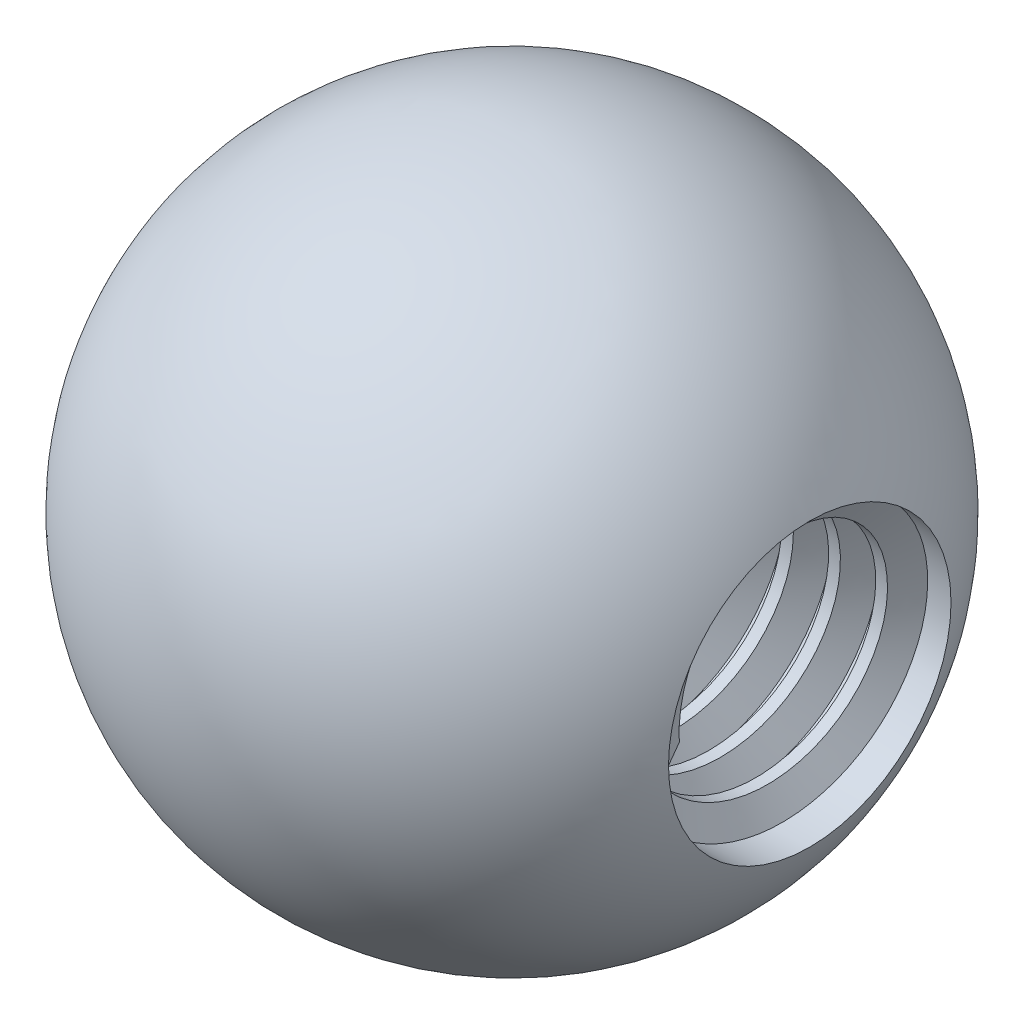
from build123d import *

# Parameters (mm, degrees)
SKETCH8_R          = 3
CUT_EXTRUDE1_DEPTH = 7
THREAD1_PITCH      = 1


with BuildPart() as part:
    # Sketch1 → Revolve1 (revolve)
    with BuildSketch(Plane.XY):
        with BuildLine():
            Line((-7, 0), (7, 0))
            ThreePointArc((7, 0), (0, 7), (-7, 0))
        make_face()
    revolve(axis=Axis((0, 0, 0), (1, 0, 0)))

    # Sketch8 → Cut-Extrude1 (cut)
    with BuildSketch(Plane(origin=(7, 0, 0), x_dir=(0, 0, -1), z_dir=(1, 0, 0))):
        Circle(SKETCH8_R)
    extrude(amount=-CUT_EXTRUDE1_DEPTH, mode=Mode.SUBTRACT)

    # Thread1: the profile of Thread Profile1 profile screwed along a right-hand helix of 7 turns, 8 arcs to a turn; built about Z, then put on its axis
    thread1_z = Axis((0, 0, 0), (0, 0, 1))
    thread1_corners = [(3.0003, 0, -0.000173205), (3.0003, 0, 0.875173202), (2.458734125, 0, 0.562499998), (2.458734125, 0, 0.312499998)]
    with BuildLine(mode=Mode.PRIVATE) as thread1_profile:
        Line(thread1_corners[0], thread1_corners[1])
        Line(thread1_corners[1], thread1_corners[2])
        Line(thread1_corners[2], thread1_corners[3])
        Line(thread1_corners[3], thread1_corners[0])
    thread1_cap = Face(thread1_profile.wire())
    thread1_turn_angles = [0, 22.5, 45, 67.5, 90, 112.5, 135, 157.5, 180, 202.5, 225, 247.5, 270, 292.5, 315, 337.5, 360]
    thread1_turn_weights = [1, 0.9238795325112867, 1, 0.9238795325112867, 1, 0.9238795325112867, 1, 0.9238795325112867, 1, 0.9238795325112867, 1, 0.9238795325112867, 1, 0.9238795325112867, 1, 0.9238795325112867, 1]
    thread1_turn_rails = [Edge.make_bspline([Vector(p[0], p[1], 0).rotate(thread1_z, thread1_turn_angles[k]) / thread1_turn_weights[k] + Vector(0, 0, p[2] + THREAD1_PITCH * thread1_turn_angles[k] / 360) for k in range(17)], [0, 0, 0, 1, 1, 2, 2, 3, 3, 4, 4, 5, 5, 6, 6, 7, 7, 8, 8, 8], 2, thread1_turn_weights) for p in thread1_corners]
    thread1_turn_sides = [Face.make_surface_from_curves(thread1_turn_rails[p[0]], thread1_turn_rails[p[1]]) for p in [(0, 1), (1, 2), (2, 3), (3, 0)]]
    thread1 = Plane(origin=(6.32455532, 0, 0), x_dir=(0, 0, 1), z_dir=(-1, 0, 0)) * Solid(Shell([*[p.moved(Location((0, 0, THREAD1_PITCH * i))) for i in range(7) for p in thread1_turn_sides], thread1_cap, thread1_cap.rotate(thread1_z, 2520).moved(Location((0, 0, THREAD1_PITCH * 2520 / 360)))]))
    add(thread1)


solid = part.part
